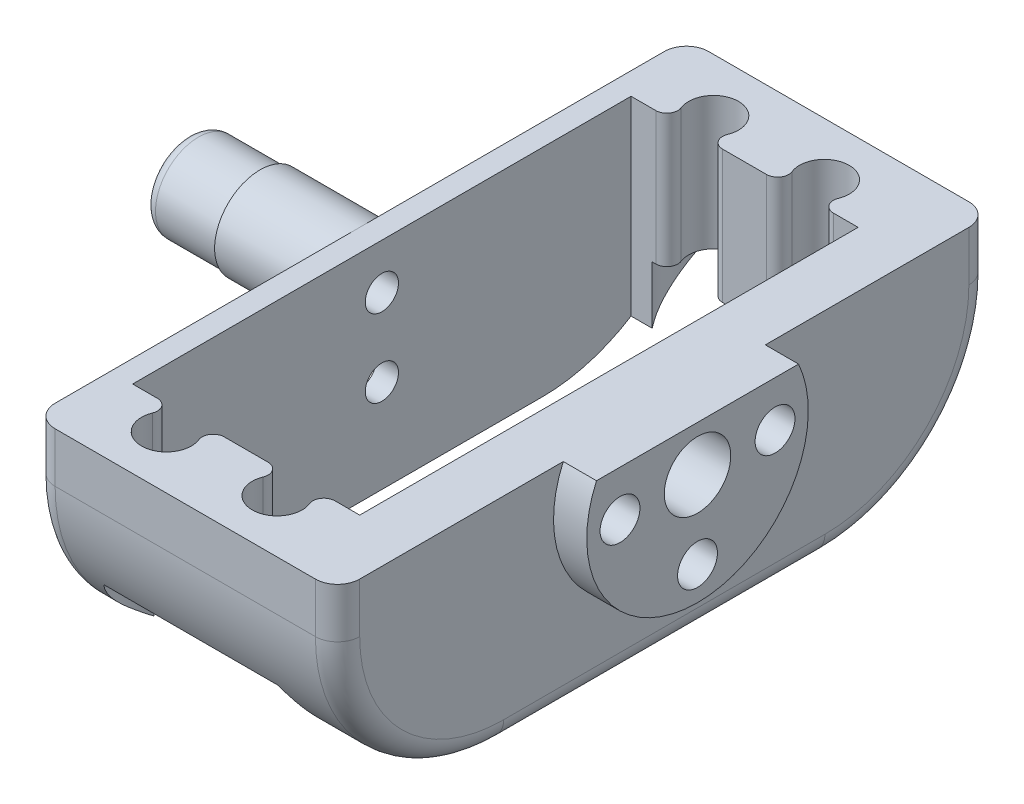
from build123d import *

# Parameters (mm, degrees)
SKETCH1_W                      = 27.5
SKETCH1_H                      = 59
SKETCH1_W_2                    = 20.5
SKETCH1_H_2                    = 45
BOSS_EXTRUDE1_DEPTH            = 19.5
CUT_EXTRUDE1_DEPTH             = 39.510550502
CUT_EXTRUDE1_DEPTH_BACK        = 39.510550502
SKETCH2_R                      = 2.25
FILLET1_R                      = 1
SKETCH4_R                      = 4.1
BOSS_EXTRUDE2_DEPTH            = 15.562278481
CBORE_FOR_M3_SHCS1_D           = 3.6
CBORE_FOR_M3_SHCS1_DEPTH       = 5
CBORE_FOR_M3_SHCS1_CBORE_D     = 6.5
CBORE_FOR_M3_SHCS1_CBORE_DEPTH = 3
CUT_EXTRUDE3_REACH             = 57.721
SKETCH5_R                      = 3
CUT_EXTRUDE11_START            = -6.562278481
SKETCH18_R                     = 4.1
SKETCH18_R_2                   = 3.875
CUT_EXTRUDE11_DEPTH            = 6.562278481
CUT_EXTRUDE12_DEPTH            = 56.721269081
CUT_EXTRUDE12_DEPTH_BACK       = 56.721269081
SKETCH20_R                     = 1.5
FILLET10_R                     = 1
CUT_EXTRUDE13_DEPTH            = 69.079165975
CUT_EXTRUDE13_DEPTH_BACK       = 69.079165975
SKETCH21_W                     = 10
SKETCH21_H                     = 15
FILLET8_R                      = 15
CUT_EXTRUDE2_START             = -12
SKETCH3_R                      = 4
CUT_EXTRUDE2_DEPTH             = 33.989141464
FILLET11_R                     = 2
BOSS_EXTRUDE3_START            = 3
SKETCH22_R                     = 1.8
SKETCH22_R_2                   = 3
BOSS_EXTRUDE3_DEPTH            = 3
SKETCH23_R                     = 1.5
CUT_EXTRUDE14_DEPTH            = 52.954182283


# Some blends are built 0.0001 mm under size
with BuildPart() as part:
    # Sketch1 → Boss-Extrude1 (new body)
    with BuildSketch(Plane(origin=(0, 0, 0), x_dir=(1, 0, 0), z_dir=(0, 1, 0))):
        with Locations((1.5, 0)):
            Rectangle(SKETCH1_W, SKETCH1_H)
        Rectangle(SKETCH1_W_2, SKETCH1_H_2, mode=Mode.SUBTRACT)
    extrude(amount=BOSS_EXTRUDE1_DEPTH)

    # Sketch2 → Cut-Extrude1 (cut, two sides: drawn at the far end of the back side and taken through both)
    with BuildSketch(Plane(origin=(0, 19.5, 0), x_dir=(1, 0, 0), z_dir=(0, 1, 0)).offset(-CUT_EXTRUDE1_DEPTH_BACK)):
        with Locations((-5, 24.7)):
            Circle(SKETCH2_R)
        with Locations((5, 24.7)):
            Circle(SKETCH2_R)
        with Locations((5, -24.7)):
            Circle(SKETCH2_R)
        with Locations((-5, -24.7)):
            Circle(SKETCH2_R)
    extrude(amount=CUT_EXTRUDE1_DEPTH + CUT_EXTRUDE1_DEPTH_BACK, mode=Mode.SUBTRACT)

    # Fillet1
    fillet1_edges = [part.edges().sort_by_distance(p)[0] for p in [
        (5.471699057, 9.75, 22.5),
        (4.528300943, 9.75, 22.5),
        (-4.528300943, 9.75, 22.5),
        (-5.471699057, 9.75, 22.5),
        (-5.471699057, 9.75, -22.5),
        (-4.528300943, 9.75, -22.5),
        (4.528300943, 9.75, -22.5),
        (5.471699057, 9.75, -22.5),
    ]]
    fillet(fillet1_edges, radius=FILLET1_R)

    # Sketch4 → Boss-Extrude2 (add)
    with BuildSketch(Plane.ZY.offset(12.25)):
        with Locations(Location((0, 15.4, 0), (0, 0, 90))):
            Circle(SKETCH4_R)
    extrude(amount=BOSS_EXTRUDE2_DEPTH)

    # CBORE for M3 SHCS1
    with Locations(Plane.ZY.offset(-10.25)):
        with Locations((-7, 15.4), (7, 15.4), (0, 8.4)):
            CounterBoreHole(CBORE_FOR_M3_SHCS1_D / 2, CBORE_FOR_M3_SHCS1_CBORE_D / 2, CBORE_FOR_M3_SHCS1_CBORE_DEPTH, depth=CBORE_FOR_M3_SHCS1_DEPTH)

    # Sketch5 → Cut-Extrude3 (cut, up to next)
    with BuildSketch(Plane(origin=(15.25, 0, 0), x_dir=(0, 0, -1), z_dir=(1, 0, 0)), mode=Mode.PRIVATE) as cut_extrude3_sk1:
        with Locations((0, 15.4)):
            Circle(SKETCH5_R)
    cut_extrude3_tool1 = extrude(cut_extrude3_sk1.sketch, amount=-CUT_EXTRUDE3_REACH, mode=Mode.PRIVATE) & part.part
    add(cut_extrude3_tool1.solids().sort_by_distance((15.25, 15.4, 0))[0], mode=Mode.SUBTRACT)

    # Sketch18 → Cut-Extrude11 (cut)
    with BuildSketch(Plane.ZY.offset(27.812278481).offset(CUT_EXTRUDE11_START)):
        with Locations(Location((0, 15.4, 0), (0, 0, 180))):
            Circle(SKETCH18_R)
        with Locations(Location((0, 15.4, 0), (0, 0, 270))):
            Circle(SKETCH18_R_2, mode=Mode.SUBTRACT)
    extrude(amount=CUT_EXTRUDE11_DEPTH, mode=Mode.SUBTRACT)

    # Sketch20 → Cut-Extrude12 (cut, two sides: drawn at the far end of the back side and taken through both)
    with BuildSketch(Plane.ZY.offset(27.812278481).offset(-CUT_EXTRUDE12_DEPTH_BACK)):
        with Locations(Location((0, 15.4, 0), (0, 0, 180))):
            Circle(SKETCH20_R)
    extrude(amount=CUT_EXTRUDE12_DEPTH + CUT_EXTRUDE12_DEPTH_BACK, mode=Mode.SUBTRACT)

    # Fillet10
    fillet10_edges = [part.edges().sort_by_distance(p)[0] for p in [
        (-27.812278481, 19.275, 0),
    ]]
    fillet(fillet10_edges, radius=FILLET10_R)

    # Sketch21 → Cut-Extrude13 (cut, two sides: drawn at the far end of the back side and taken through both)
    with BuildSketch(Plane(origin=(0, 0, -29.5), x_dir=(-1, 0, 0), z_dir=(0, 0, -1)).offset(-CUT_EXTRUDE13_DEPTH_BACK)):
        Rectangle(SKETCH21_W, SKETCH21_H)
    extrude(amount=CUT_EXTRUDE13_DEPTH + CUT_EXTRUDE13_DEPTH_BACK, mode=Mode.SUBTRACT)

    # Fillet8
    # the kernel refuses this fillet: 15 mm, written as the material it takes off along each edge
    with BuildSketch(Plane(origin=(-49.75, 0, 29.5), x_dir=(0, 0, -1), z_dir=(1, 0, 0)), Plane(origin=(32.5, 0, -29.5), x_dir=(0, 0, 1), z_dir=(-1, 0, 0))) as fillet8_piece_1:
        with BuildLine():
            CenterArc((FILLET8_R, FILLET8_R), FILLET8_R, 180, 90)
            Line((0, FILLET8_R), (0, 0))
            Line((0, 0), (FILLET8_R, 0))
        make_face()
    extrude(amount=82.25, mode=Mode.SUBTRACT)
    with BuildSketch(Plane(origin=(-32.5, 0, 29.5), x_dir=(0, 1, 0), z_dir=(1, 0, 0)), Plane(origin=(52.75, 0, -29.5), x_dir=(0, 1, 0), z_dir=(-1, 0, 0))) as fillet8_piece_2:
        with BuildLine():
            CenterArc((FILLET8_R, -FILLET8_R), FILLET8_R, 90, 90)
            Line((0, -FILLET8_R), (0, 0))
            Line((0, 0), (FILLET8_R, 0))
        make_face()
    extrude(amount=85.25, mode=Mode.SUBTRACT)

    # Sketch3 → Cut-Extrude2 (cut, through all)
    with BuildSketch(Plane(origin=(0, 19.5, 0), x_dir=(1, 0, 0), z_dir=(0, 1, 0)).offset(CUT_EXTRUDE2_START)):
        with Locations((-5, -24.7)):
            Circle(SKETCH3_R)
        with Locations((5, -24.7)):
            Circle(SKETCH3_R)
        with Locations((5, 24.7)):
            Circle(SKETCH3_R)
        with Locations((-5, 24.7)):
            Circle(SKETCH3_R)
    extrude(amount=-CUT_EXTRUDE2_DEPTH, mode=Mode.SUBTRACT)

    # Fillet11
    fillet11_edges = [part.edges().sort_by_distance(p)[0] for p in [
        (-12.25, 0, 0),
        (-12.25, 4.393398282, 25.106601718),
        (-12.25, 4.393398282, -25.106601718),
        (15.25, 0, 0),
        (15.25, 4.393398282, -25.106601718),
        (15.25, 4.393398282, 25.106601718),
        (15.25, 17.25, 29.5),
        (-12.25, 17.25, 29.5),
        (-12.25, 17.25, -29.5),
        (15.25, 17.25, -29.5),
    ]]
    fillet(fillet11_edges, radius=FILLET11_R - 0.0001)  # a hair under: the kernel refuses the full size

    # Sketch22 → Boss-Extrude3 (add)
    with BuildSketch(Plane(origin=(15.25, 0, 0), x_dir=(0, 0, -1), z_dir=(1, 0, 0)).offset(BOSS_EXTRUDE3_START)):
        with BuildLine():
            Line((9.120855223, 19.5), (-9.120855223, 19.5))
            ThreePointArc((-9.120855223, 19.5), (0, 5.4), (9.120855223, 19.5))
        make_face()
        with Locations(Location((7, 15.4, 0), (0, 0, 180))):
            Circle(SKETCH22_R, mode=Mode.SUBTRACT)
        with Locations(Location((0, 8.4, 0), (0, 0, 180))):
            Circle(SKETCH22_R, mode=Mode.SUBTRACT)
        with Locations((0, 15.4)):
            Circle(SKETCH22_R_2, mode=Mode.SUBTRACT)
        with Locations(Location((-7, 15.4, 0), (0, 0, 180))):
            Circle(SKETCH22_R, mode=Mode.SUBTRACT)
    extrude(amount=-BOSS_EXTRUDE3_DEPTH)

    # Sketch23 → Cut-Extrude14 (cut, through all)
    with BuildSketch(Plane.ZY.offset(-10.25)):
        with Locations(Location((0, 8.4, 0), (0, 0, 180))):
            Circle(SKETCH23_R)
    extrude(amount=CUT_EXTRUDE14_DEPTH, mode=Mode.SUBTRACT)


solid = part.part
